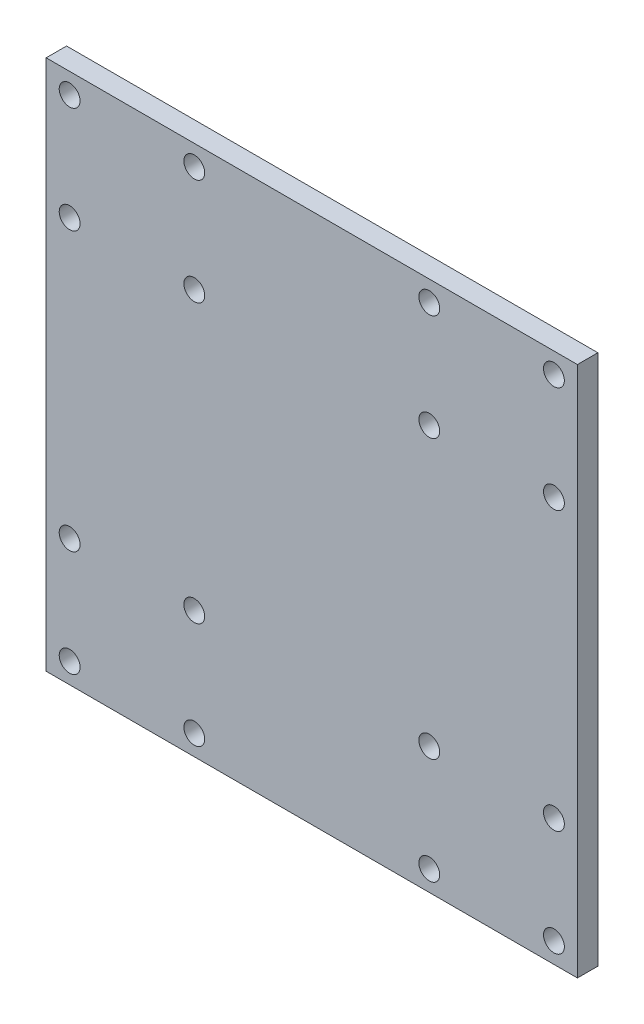
from build123d import *

# Parameters (mm, degrees)
SKETCH1_W           = 130
SKETCH1_H           = 130
BOSS_EXTRUDE1_DEPTH = 2.5
SKETCH2_R           = 2.55
CUT_EXTRUDE1_DEPTH  = 93.059763198


with BuildPart() as part:
    # Sketch1 → Boss-Extrude1 (new, symmetric)
    with BuildSketch(Plane.XY):
        Rectangle(SKETCH1_W, SKETCH1_H)
    extrude(amount=BOSS_EXTRUDE1_DEPTH, both=True)

    # Sketch2 → Cut-Extrude1 (cut, through all)
    with BuildSketch(Plane.XY.offset(2.5)):
        with Locations((-59.25, 60)):
            Circle(SKETCH2_R)
        with Locations((-28.75, 60)):
            Circle(SKETCH2_R)
        with Locations((-28.75, 34)):
            Circle(SKETCH2_R)
        with Locations((-59.25, 34)):
            Circle(SKETCH2_R)
        with Locations((59.25, 60)):
            Circle(SKETCH2_R)
        with Locations((59.25, 34)):
            Circle(SKETCH2_R)
        with Locations((28.75, 34)):
            Circle(SKETCH2_R)
        with Locations((28.75, 60)):
            Circle(SKETCH2_R)
        with Locations((-59.25, -34)):
            Circle(SKETCH2_R)
        with Locations((-28.75, -34)):
            Circle(SKETCH2_R)
        with Locations((-28.75, -60)):
            Circle(SKETCH2_R)
        with Locations((-59.25, -60)):
            Circle(SKETCH2_R)
        with Locations((28.75, -34)):
            Circle(SKETCH2_R)
        with Locations((59.25, -34)):
            Circle(SKETCH2_R)
        with Locations((59.25, -60)):
            Circle(SKETCH2_R)
        with Locations((28.75, -60)):
            Circle(SKETCH2_R)
    extrude(amount=-CUT_EXTRUDE1_DEPTH, mode=Mode.SUBTRACT)


solid = part.part
